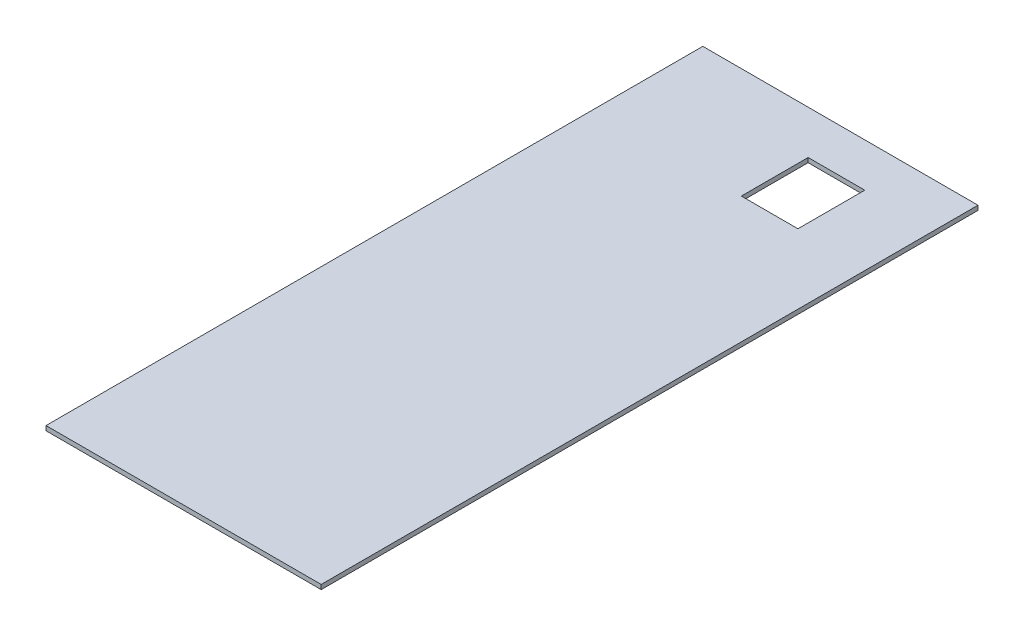
from build123d import *

# Parameters (mm, degrees)
SKETCH1_W           = 486
SKETCH1_H           = 1160
BOSS_EXTRUDE1_DEPTH = 4
SKETCH3_W           = 100
SKETCH3_H           = 118
CUT_EXTRUDE1_DEPTH  = 25


with BuildPart() as part:
    # Sketch1 → Boss-Extrude1 (new, symmetric)
    with BuildSketch(Plane(origin=(0, 0, 0), x_dir=(1, 0, 0), z_dir=(0, 1, 0))):
        Rectangle(SKETCH1_W, SKETCH1_H)
    extrude(amount=BOSS_EXTRUDE1_DEPTH, both=True)

    # Sketch3 → Cut-Extrude1 (cut, symmetric)
    with BuildSketch(Plane(origin=(0, 0, 0), x_dir=(1, 0, 0), z_dir=(0, 1, 0))):
        with Locations((70, 444)):
            Rectangle(SKETCH3_W, SKETCH3_H)
    extrude(amount=CUT_EXTRUDE1_DEPTH, both=True, mode=Mode.SUBTRACT)


solid = part.part
